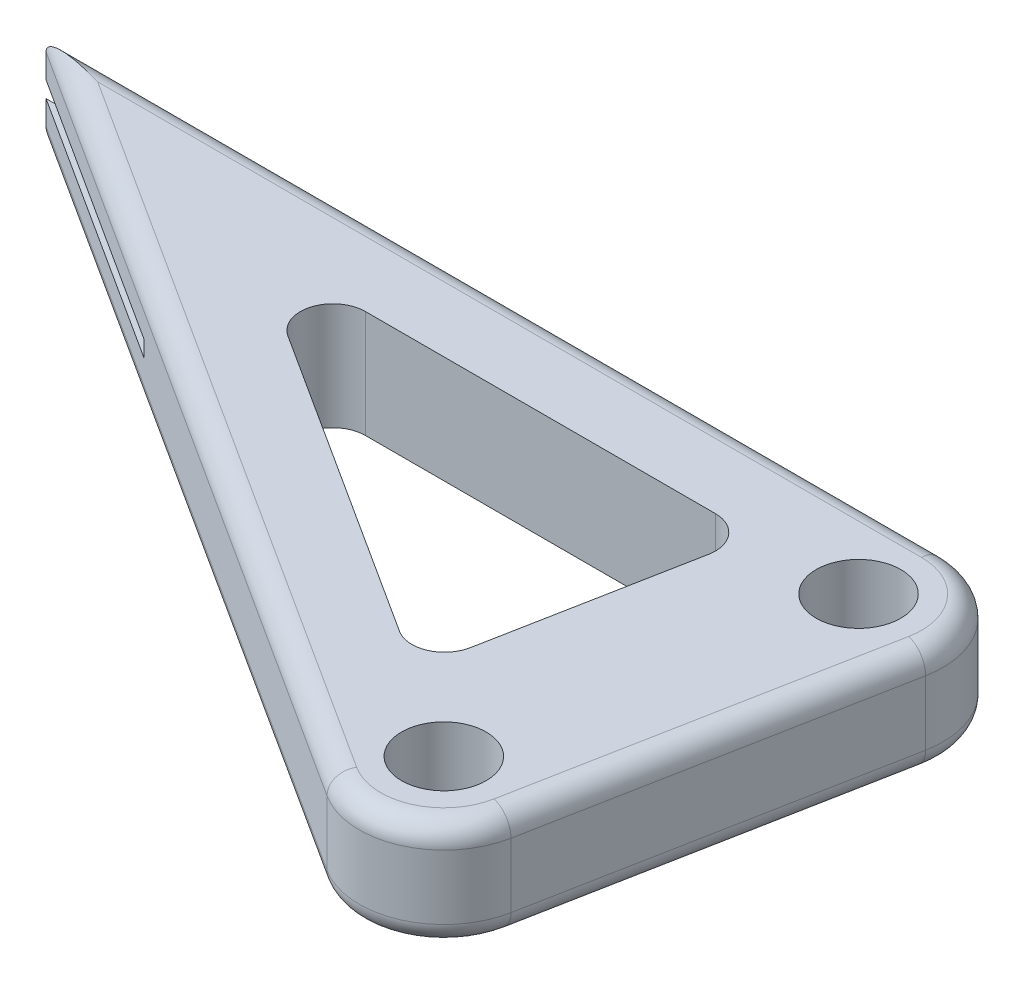
from build123d import *
from OCP.BRepAlgoAPI import BRepAlgoAPI_Cut
from OCP.TopTools import TopTools_ListOfShape

# Parameters (mm, degrees)
SKETCH1_R           = 5
BOSS_EXTRUDE1_DEPTH = 12.7
FILLET1_R           = 2.54
SCALE1_SCALE        = 0.66
CUT_EXTRUDE1_DEPTH  = 91.122674363
FILLET2_R           = 2.54
CUT_EXTRUDE2_DEPTH  = 25.4


with BuildPart() as part:
    # Sketch1 → Boss-Extrude1 (new body)
    with BuildSketch(Plane(origin=(0, 0, 0), x_dir=(1, 0, 0), z_dir=(0, 1, 0))):
        with BuildLine():
            Line((-77.410829365, -8.41547619), (-13.284900793, -49.577415951))
            ThreePointArc((-13.284900793, -49.577415951), (-3.938658922, -50.351151369), (1.938436508, -43.042892142))
            Line((1.938436508, -43.042892142), (9.821507936, -1.880952381))
            ThreePointArc((9.821507936, -1.880952381), (7.707448469, 6.371439248), (0, 10))
            Line((0, 10), (-72.009, 10))
            Line((-72.009, 10), (-106.100184572, 10))
            Line((-106.100184572, 10), (-77.410829365, -8.41547619))
        make_face()
        Circle(SKETCH1_R, mode=Mode.SUBTRACT)
        with Locations((-7.883071429, -41.161939761)):
            Circle(SKETCH1_R, mode=Mode.SUBTRACT)
    extrude(amount=BOSS_EXTRUDE1_DEPTH)

    # Fillet1
    fillet1_edges = [part.edges().sort_by_distance(p)[0] for p in [
        (-53.050092286, 0, -10),
        (7.707448469, 0, -6.371439248),
        (5.879972222, 0, 22.461922261),
        (-3.938658922, 0, 50.351151369),
        (-53.050092286, 12.7, -10),
        (7.707448469, 12.7, -6.371439248),
        (5.879972222, 12.7, 22.461922261),
        (-3.938658922, 12.7, 50.351151369),
        (-59.692542683, 0, 19.788707976),
        (-59.692542683, 12.7, 19.788707976),
    ]]
    fillet(fillet1_edges, radius=FILLET1_R)


with BuildPart() as part_1:
    # Scale1: scaled about (-33.401454618, 6.35, 11.856994793)
    add(part.part.scale(SCALE1_SCALE).moved(Location((-11.35649457, 2.159, 4.03137823))))


with BuildPart() as cut_extrude1_tool:
    # Sketch2 → Cut-Extrude1 (new, through all)
    with BuildSketch(Plane(origin=(0, 10.540994585, 0), x_dir=(1, 0, 0), z_dir=(0, 1, 0))):
        Polygon((-58.349296315, -4.187754758), (-23.578618247, -26.506785264), (-19.304220279, -4.187754758), align=None)
    extrude(amount=-CUT_EXTRUDE1_DEPTH)


with BuildPart() as part_2:
    add(part_1.part)

    # Cut-Extrude1: cut by cut_extrude1_tool, with a tolerance
    cut_extrude1_stock = TopTools_ListOfShape()
    cut_extrude1_stock.Append(part_2.part.wrapped)
    cut_extrude1_tools = TopTools_ListOfShape()
    cut_extrude1_tools.Append(cut_extrude1_tool.part.wrapped)
    cut_extrude1_cut = BRepAlgoAPI_Cut()
    cut_extrude1_cut.SetArguments(cut_extrude1_stock)
    cut_extrude1_cut.SetTools(cut_extrude1_tools)
    cut_extrude1_cut.SetFuzzyValue(0.00001)
    cut_extrude1_cut.Build()
    add(Compound.cast(cut_extrude1_cut.Shape()).solids(), mode=Mode.REPLACE)

    # Fillet2
    fillet2_edges = [part_2.edges().sort_by_distance(p)[0] for p in [
        (-23.578618247, 6.349997293, 26.506785264),
        (-19.304220279, 6.349997293, 4.187754758),
        (-58.349296315, 6.349997293, 4.187754758),
    ]]
    fillet(fillet2_edges, radius=FILLET2_R)

    # Sketch3 → Cut-Extrude2 (cut)
    with BuildSketch(Plane(origin=(-58.803077328, 0, -37.745242535), x_dir=(0, -1, 0), z_dir=(-0.841547619047619, 0, -0.5401829364902999))):
        Polygon((-5.714994585, 41.799889271), (-5.714994585, 39.894889271), (-5.079994585, 39.894889271), (-5.079994585, 38.624889271), (-7.619994585, 38.624889271), (-7.619994585, 39.894889271), (-6.984994585, 39.894889271), (-6.984994585, 41.799889271), align=None)
    extrude(amount=-CUT_EXTRUDE2_DEPTH, mode=Mode.SUBTRACT)


solid = part_2.part
